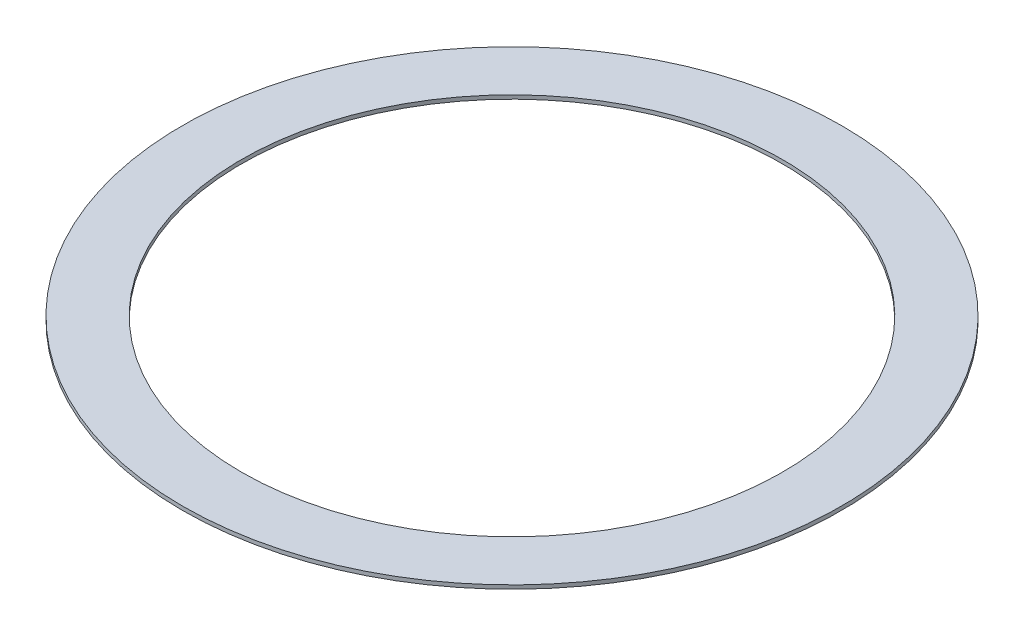
from build123d import *

# Parameters (mm, degrees)
SKETCH1_R           = 435
SKETCH1_R_2         = 357.27922
BOSS_EXTRUDE1_DEPTH = 5


with BuildPart() as part:
    # Sketch1 → Boss-Extrude1 (new body)
    with BuildSketch(Plane(origin=(0, 0, 0), x_dir=(1, 0, 0), z_dir=(0, 1, 0))):
        Circle(SKETCH1_R)
        Circle(SKETCH1_R_2, mode=Mode.SUBTRACT)
    extrude(amount=BOSS_EXTRUDE1_DEPTH)


solid = part.part
